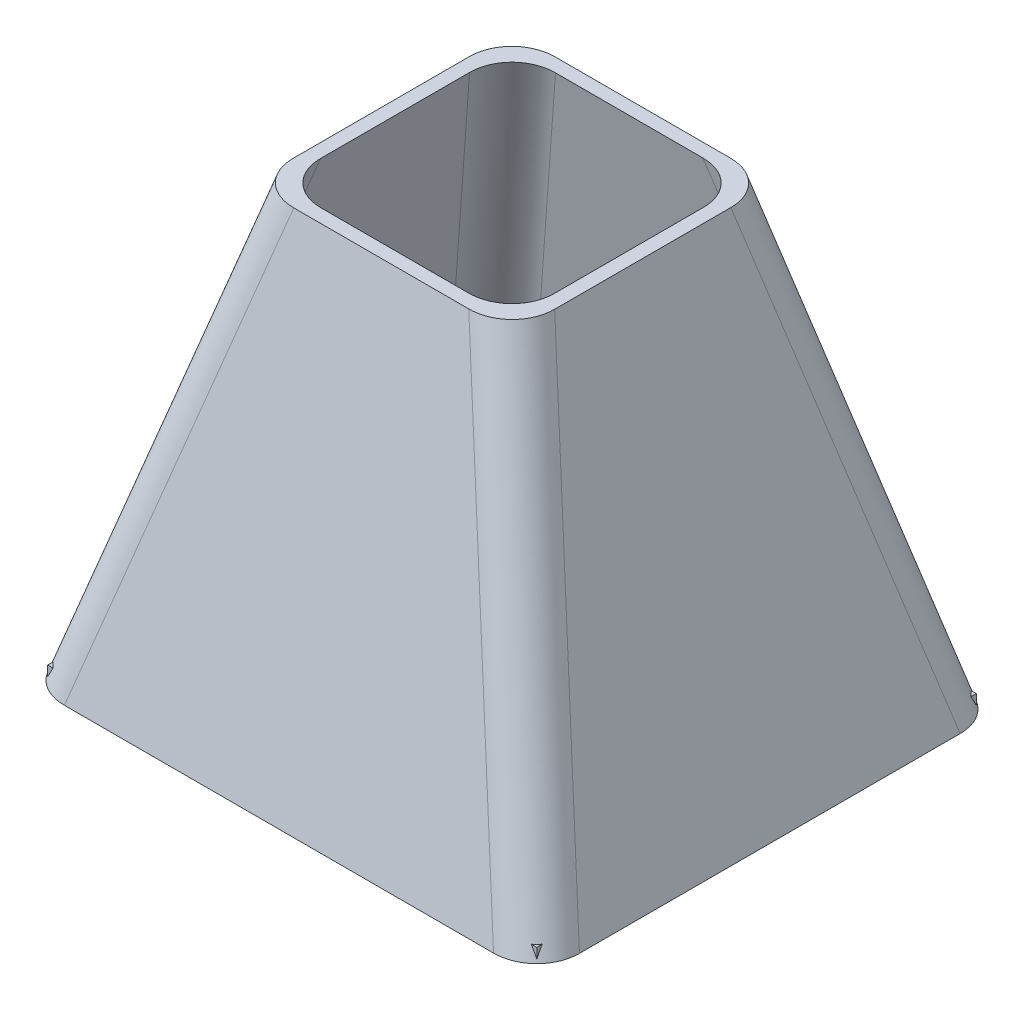
from build123d import *

# Parameters (mm, degrees)
SKETCH1_W           = 59
SKETCH1_H           = 59
BOSS_EXTRUDE1_DEPTH = 100
DRAFT1_ANGLE        = 13
DRAFT2_ANGLE        = 16
SHELL1_T            = -3
SKETCH3_W           = 110.349077152
SKETCH3_H           = 99.173638226
CUT_EXTRUDE2_DEPTH  = 3
FILLET1_R           = 10


with BuildPart() as part:
    # Sketch1 → Boss-Extrude1 (new body)
    with BuildSketch(Plane(origin=(0, 0, 0), x_dir=(1, 0, 0), z_dir=(0, 1, 0))):
        Rectangle(SKETCH1_W, SKETCH1_H)
    extrude(amount=-BOSS_EXTRUDE1_DEPTH)

    # Draft1
    draft1_faces = [part.faces().sort_by_distance(p)[0] for p in [
        (0, -50, 29.5),
        (0, -50, -29.5),
    ]]
    draft(draft1_faces, Plane.ZX, DRAFT1_ANGLE)

    # Draft2
    draft2_faces = [part.faces().sort_by_distance(p)[0] for p in [
        (-29.5, -54.687479947, 0),
        (29.5, -54.687479947, 0),
    ]]
    draft(draft2_faces, Plane.ZX, DRAFT2_ANGLE)

    # Shell1
    shell1_openings = [part.faces().sort_by_distance(p)[0] for p in [
        (0, 0, 0),
    ]]
    offset(amount=SHELL1_T, openings=shell1_openings, kind=Kind.INTERSECTION)

    # Sketch3 → Cut-Extrude2 (cut)
    with BuildSketch(Plane.XZ.offset(100)):
        Rectangle(SKETCH3_W, SKETCH3_H)
    extrude(amount=-CUT_EXTRUDE2_DEPTH, mode=Mode.SUBTRACT)

    # Fillet1
    fillet1_edges = [part.edges().sort_by_distance(p)[0] for p in [
        (-40.286252902, -48.5, 37.618194946),
        (40.286252902, -48.5, 37.618194946),
        (40.286252902, -48.5, -37.618194946),
        (-40.286252902, -48.5, -37.618194946),
        (43.837269288, -50, 41.043409556),
        (-43.837269288, -50, 41.043409556),
        (-43.837269288, -50, -41.043409556),
        (43.837269288, -50, -41.043409556),
    ]]
    fillet(fillet1_edges, radius=FILLET1_R)


solid = part.part
